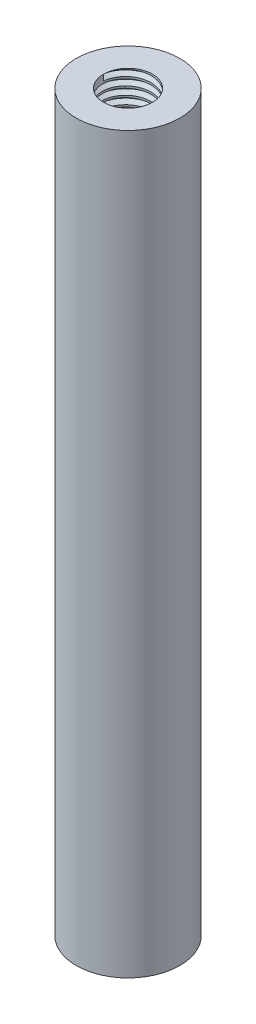
from build123d import *

# Parameters (mm, degrees)
SKETCH1_R                       = 6.35
BOSS_EXTRUDE1_DEPTH             = 90
TAP_DRILL_FOR_M7X1_0_TAP1_D     = 6
TAP_DRILL_FOR_M7X1_0_TAP1_DEPTH = 25.4
TAP_DRILL_FOR_M7X1_0_TAP1_TIP   = 1.802581857
THREAD1_PITCH                   = 1
TAP_DRILL_FOR_1_4_20_TAP1_D     = 5.1054
TAP_DRILL_FOR_1_4_20_TAP1_DEPTH = 25.4
TAP_DRILL_FOR_1_4_20_TAP1_TIP   = 1.533816902
THREAD2_PITCH                   = 1.27


with BuildPart() as part:
    # Sketch1 → Boss-Extrude1 (new body)
    with BuildSketch(Plane(origin=(0, 0, 0), x_dir=(1, 0, 0), z_dir=(0, 1, 0))):
        with Locations(Location((0, 0, 0), (0, 0, 90))):
            Circle(SKETCH1_R)
    extrude(amount=BOSS_EXTRUDE1_DEPTH)

    # Tap Drill for M7x1.0 Tap1
    with Locations(Plane(origin=(0, 90, 0), x_dir=(1, 0, 0), z_dir=(0, 1, 0))):
        with Locations((0, 0)):
            Hole(TAP_DRILL_FOR_M7X1_0_TAP1_D / 2, depth=TAP_DRILL_FOR_M7X1_0_TAP1_DEPTH)
            with Locations((0, 0, -(TAP_DRILL_FOR_M7X1_0_TAP1_DEPTH + TAP_DRILL_FOR_M7X1_0_TAP1_TIP / 2))):  # 118° drill point
                Cone(0, TAP_DRILL_FOR_M7X1_0_TAP1_D / 2, TAP_DRILL_FOR_M7X1_0_TAP1_TIP, mode=Mode.SUBTRACT)

    # Thread1: arcs per turn and ends read off the stored shape
    # Thread1: the profile of Thread Profile1 profile screwed along a right-hand helix through 25.4 turns, 8 arcs to a turn; built about Z, then put on its axis
    thread1_z = Axis((0, 0, 0), (0, 0, 1))
    thread1_corners = [(2.9997, 0, -0.000173205), (3.541265875, 0, 0.312499999), (3.541265875, 0, 0.437499999), (2.9997, 0, 0.750173202)]
    with BuildLine(mode=Mode.PRIVATE) as thread1_profile:
        Line(thread1_corners[0], thread1_corners[1])
        Line(thread1_corners[1], thread1_corners[2])
        Line(thread1_corners[2], thread1_corners[3])
        Line(thread1_corners[3], thread1_corners[0])
    thread1_cap = Face(thread1_profile.wire())
    thread1_turn_angles = [0, 22.5, 45, 67.5, 90, 112.5, 135, 157.5, 180, 202.5, 225, 247.5, 270, 292.5, 315, 337.5, 360]
    thread1_turn_weights = [1, 0.9238795325112867, 1, 0.9238795325112867, 1, 0.9238795325112867, 1, 0.9238795325112867, 1, 0.9238795325112867, 1, 0.9238795325112867, 1, 0.9238795325112867, 1, 0.9238795325112867, 1]
    thread1_turn_rails = [Edge.make_bspline([Vector(p[0], p[1], 0).rotate(thread1_z, thread1_turn_angles[k]) / thread1_turn_weights[k] + Vector(0, 0, p[2] + THREAD1_PITCH * thread1_turn_angles[k] / 360) for k in range(17)], [0, 0, 0, 1, 1, 2, 2, 3, 3, 4, 4, 5, 5, 6, 6, 7, 7, 8, 8, 8], 2, thread1_turn_weights) for p in thread1_corners]
    thread1_turn_sides = [Face.make_surface_from_curves(thread1_turn_rails[p[0]], thread1_turn_rails[p[1]]) for p in [(0, 1), (1, 2), (2, 3), (3, 0)]]
    thread1_last_angles = [9000, 9022.5, 9045, 9067.5, 9090, 9112.5, 9135, 9139.5, 9144]
    thread1_last_weights = [1, 0.9238795325112867, 1, 0.9238795325112867, 1, 0.9238795325112867, 1, 0.9969173337331267, 1]
    thread1_last_rails = [Edge.make_bspline([Vector(p[0], p[1], 0).rotate(thread1_z, thread1_last_angles[k]) / thread1_last_weights[k] + Vector(0, 0, p[2] + THREAD1_PITCH * thread1_last_angles[k] / 360) for k in range(9)], [0, 0, 0, 1, 1, 2, 2, 3, 3, 4, 4, 4], 2, thread1_last_weights) for p in thread1_corners]
    thread1_last_sides = [Face.make_surface_from_curves(thread1_last_rails[p[0]], thread1_last_rails[p[1]]) for p in [(0, 1), (1, 2), (2, 3), (3, 0)]]
    thread1 = Plane(origin=(0, 90, 0), x_dir=(-1, 0, 0), z_dir=(0, -1, 0)) * Solid(Shell([*[p.moved(Location((0, 0, THREAD1_PITCH * i))) for i in range(25) for p in thread1_turn_sides], *thread1_last_sides, thread1_cap, thread1_cap.rotate(thread1_z, 9144).moved(Location((0, 0, THREAD1_PITCH * 9144 / 360)))]))
    add(thread1, mode=Mode.SUBTRACT)

    # Tap Drill for 1/4-20 Tap1
    with Locations(Plane(origin=(0, 0, 0), x_dir=(-1, 0, 0), z_dir=(0, -1, 0))):
        with Locations((0, 0)):
            Hole(TAP_DRILL_FOR_1_4_20_TAP1_D / 2, depth=TAP_DRILL_FOR_1_4_20_TAP1_DEPTH)
            with Locations((0, 0, -(TAP_DRILL_FOR_1_4_20_TAP1_DEPTH + TAP_DRILL_FOR_1_4_20_TAP1_TIP / 2))):  # 118° drill point
                Cone(0, TAP_DRILL_FOR_1_4_20_TAP1_D / 2, TAP_DRILL_FOR_1_4_20_TAP1_TIP, mode=Mode.SUBTRACT)

    # Thread2: arcs per turn and ends read off the stored shape
    # Thread2: the profile of Thread Profile2 profile screwed along a right-hand helix through 20 turns, 8 arcs to a turn; built about Z, then put on its axis
    thread2_z = Axis((0, 0, 0), (0, 0, 1))
    thread2_corners = [(2.5524, 0, -0.000173205), (3.240107661, 0, 0.396874998), (3.240107661, 0, 0.555624998), (2.5524, 0, 0.952673202)]
    with BuildLine(mode=Mode.PRIVATE) as thread2_profile:
        Line(thread2_corners[0], thread2_corners[1])
        Line(thread2_corners[1], thread2_corners[2])
        Line(thread2_corners[2], thread2_corners[3])
        Line(thread2_corners[3], thread2_corners[0])
    thread2_cap = Face(thread2_profile.wire())
    thread2_turn_angles = [0, 22.5, 45, 67.5, 90, 112.5, 135, 157.5, 180, 202.5, 225, 247.5, 270, 292.5, 315, 337.5, 360]
    thread2_turn_weights = [1, 0.9238795325112867, 1, 0.9238795325112867, 1, 0.9238795325112867, 1, 0.9238795325112867, 1, 0.9238795325112867, 1, 0.9238795325112867, 1, 0.9238795325112867, 1, 0.9238795325112867, 1]
    thread2_turn_rails = [Edge.make_bspline([Vector(p[0], p[1], 0).rotate(thread2_z, thread2_turn_angles[k]) / thread2_turn_weights[k] + Vector(0, 0, p[2] + THREAD2_PITCH * thread2_turn_angles[k] / 360) for k in range(17)], [0, 0, 0, 1, 1, 2, 2, 3, 3, 4, 4, 5, 5, 6, 6, 7, 7, 8, 8, 8], 2, thread2_turn_weights) for p in thread2_corners]
    thread2_turn_sides = [Face.make_surface_from_curves(thread2_turn_rails[p[0]], thread2_turn_rails[p[1]]) for p in [(0, 1), (1, 2), (2, 3), (3, 0)]]
    thread2 = Plane(origin=(0, 0, 0), x_dir=(1, 0, 0), z_dir=(0, 1, 0)) * Solid(Shell([*[p.moved(Location((0, 0, THREAD2_PITCH * i))) for i in range(20) for p in thread2_turn_sides], thread2_cap, thread2_cap.rotate(thread2_z, 7200).moved(Location((0, 0, THREAD2_PITCH * 7200 / 360)))]))
    add(thread2, mode=Mode.SUBTRACT)


solid = part.part
